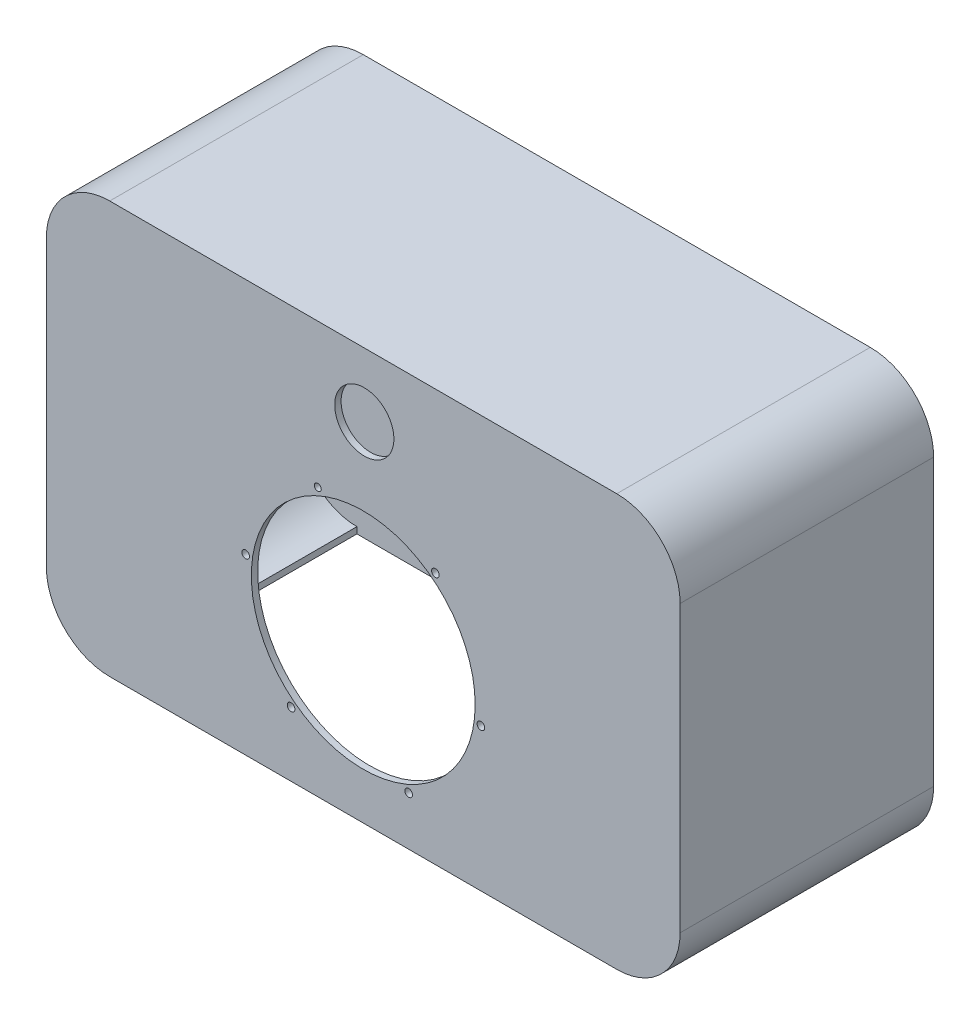
from build123d import *

# Parameters (mm, degrees)
BOSS_EXTRU_1_DEPTH      = 40
COQUE1_START            = 1
COQUE1_DEPTH            = 38
ESQUISSE2_R             = 4.67
ESQUISSE2_R_2           = 17.660377339
ESQUISSE2_R_3           = 0.603773585
ESQUISSE2_R_4           = 0.543253327
ENL_V_MAT_EXTRU_1_DEPTH = 5
ESQUISSE3_R             = 1.5
BOSS_EXTRU_2_DEPTH      = 5
CONG_1_R                = 5


# Read off the part's stored shape, not the designer's step: Coque1
with BuildPart() as part:
    # Esquisse1 → Boss.-Extru.1 (new body)
    with BuildSketch(Plane.XY):
        with BuildLine():
            Line((-40, 32.5), (40, 32.5))
            ThreePointArc((40, 32.5), (47.071067812, 29.571067812), (50, 22.5))
            Line((50, 22.5), (50, -22.5))
            ThreePointArc((50, -22.5), (47.071067812, -29.571067812), (40, -32.5))
            Line((40, -32.5), (-40, -32.5))
            ThreePointArc((-40, -32.5), (-47.071067812, -29.571067812), (-50, -22.5))
            Line((-50, -22.5), (-50, 22.5))
            ThreePointArc((-50, 22.5), (-47.071067812, 29.571067812), (-40, 32.5))
        make_face()
    extrude(amount=BOSS_EXTRU_1_DEPTH)

    # Coque1 outline → Coque1 (cut)
    with BuildSketch(Plane.XY.offset(COQUE1_START)):
        with BuildLine():
            Line((-40, -31.5), (-40, -32.5))
            Line((-40, -32.5), (40, -32.5))
            Line((40, -32.5), (40, -31.5))
            ThreePointArc((40, -31.5), (46.363961031, -28.863961031), (49, -22.5))
            Line((49, -22.5), (49, 22.5))
            ThreePointArc((49, 22.5), (46.363961031, 28.863961031), (40, 31.5))
            Line((40, 31.5), (-40, 31.5))
            ThreePointArc((-40, 31.5), (-46.363961031, 28.863961031), (-49, 22.5))
            Line((-49, 22.5), (-49, -22.5))
            ThreePointArc((-49, -22.5), (-46.363961031, -28.863961031), (-40, -31.5))
        make_face()
    extrude(amount=COQUE1_DEPTH, mode=Mode.SUBTRACT)

    # Esquisse2 → Enlèv. mat.-Extru.1 (cut)
    with BuildSketch(Plane.XY.offset(40)):
        with Locations((0.168563894, 22.39389783)):
            Circle(ESQUISSE2_R)
        with Locations((-2.4e-08, -7.499999903)):
            Circle(ESQUISSE2_R_2)
        with Locations((-18.557820098, -5.064287395)):
            Circle(ESQUISSE2_R_3)
        with Locations((18.557820098, -9.935712605)):
            Circle(ESQUISSE2_R_3)
        with Locations((11.388299042, 7.353687341)):
            Circle(ESQUISSE2_R_3)
        with Locations((-7.169521057, 9.789399947)):
            Circle(ESQUISSE2_R_4)
        with Locations((7.169521057, -24.789399947)):
            Circle(ESQUISSE2_R_3)
        with Locations((-11.388299042, -22.353687341)):
            Circle(ESQUISSE2_R_3)
    extrude(amount=-ENL_V_MAT_EXTRU_1_DEPTH, mode=Mode.SUBTRACT)

    # Esquisse3 → Boss.-Extru.2 (add)
    with BuildSketch(Plane.XZ.offset(32.5)):
        with BuildLine():
            Line((-12.5, -9), (12.5, -9))
            ThreePointArc((12.5, -9), (14.267766953, -8.267766953), (15, -6.5))
            Line((15, -6.5), (15, 1))
            Line((15, 1), (-15, 1))
            Line((-15, 1), (-15, -6.5))
            ThreePointArc((-15, -6.5), (-14.267766953, -8.267766953), (-12.5, -9))
        make_face()
        with Locations(Location((-10, -4, 0), (0, 0, 270))):
            Circle(ESQUISSE3_R, mode=Mode.SUBTRACT)
        with Locations(Location((10, -4, 0), (0, 0, 90))):
            Circle(ESQUISSE3_R, mode=Mode.SUBTRACT)
    extrude(amount=-BOSS_EXTRU_2_DEPTH)

    # Congé1
    cong_1_edges = [part.edges().sort_by_distance(p)[0] for p in [
        (-15, -30, 0),
        (15, -30, 0),
    ]]
    fillet(cong_1_edges, radius=CONG_1_R)


solid = part.part
